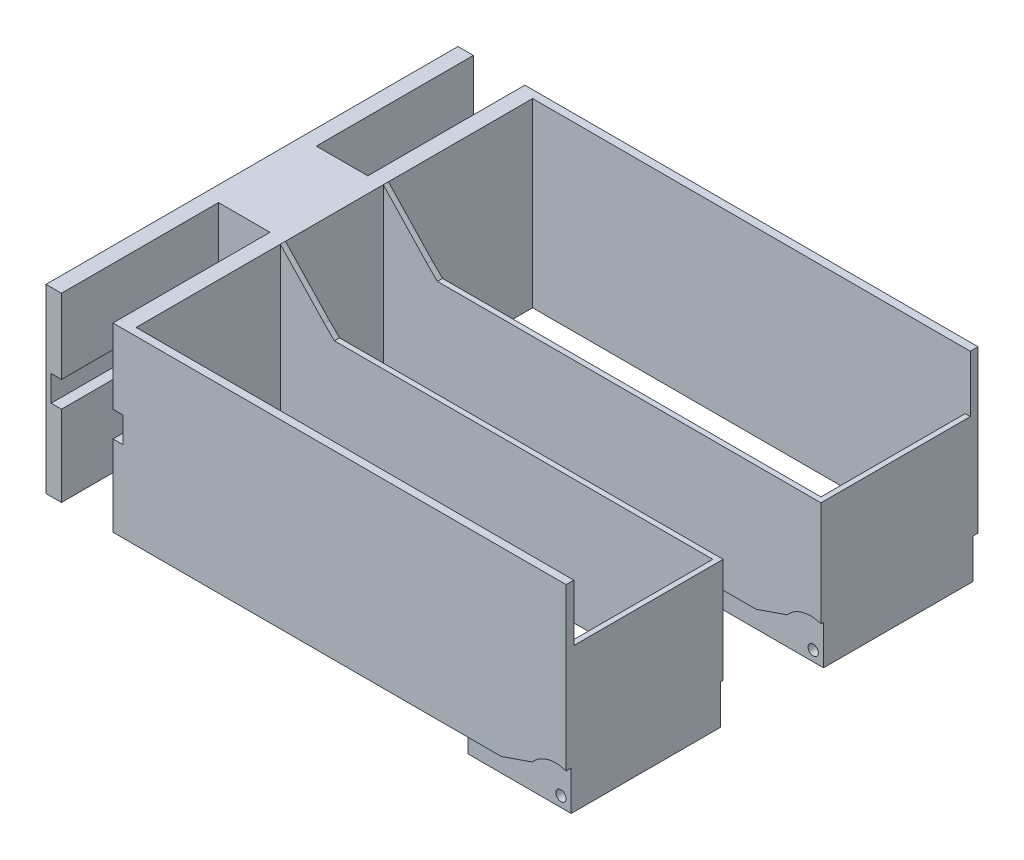
from build123d import *

# Parameters (mm, degrees)
SKETCH4_W                 = 85
SKETCH4_H                 = 39
BOSS_EXTRUDE2_DEPTH       = 30
BOSS_EXTRUDE3_DEPTH       = 39
SKETCH7_W                 = 84
SKETCH7_H                 = 28
CUT_EXTRUDE1_DEPTH        = 39
CUT_EXTRUDE2_DEPTH        = 1
SKETCH9_W                 = 1
SKETCH9_H                 = 9
CUT_EXTRUDE4_DEPTH        = 28
SKETCH19_W                = 31
SKETCH19_H                = 39
BOSS_EXTRUDE4_DEPTH       = 2
SKETCH20_W                = 3
SKETCH20_H                = 39
BOSS_EXTRUDE5_DEPTH       = 9
SKETCH38_W                = 1
SKETCH38_H                = 29
BOSS_EXTRUDE6_DEPTH       = 9
SKETCH39_W                = 1
SKETCH39_H                = 39
BOSS_EXTRUDE7_DEPTH       = 47.410129
BOSS_EXTRUDE8_DEPTH       = 28
SKETCH42_W                = 2
SKETCH42_H                = 5
CUT_EXTRUDE5_DEPTH        = 30
BOSS_EXTRUDE9_DEPTH       = 1
SKETCH44_R                = 1
CUT_EXTRUDE7_DEPTH        = 32
SKETCH46_W                = 85
SKETCH46_H                = 3.803593904
CUT_EXTRUDE8_DEPTH        = 1
CUT_EXTRUDE9_START        = -1
SKETCH48_W                = 65
SKETCH48_H                = 1.901796952
CUT_EXTRUDE9_DEPTH        = 30
SKETCH49_R                = 6
CUT_EXTRUDE10_DEPTH       = 1
CUT_EXTRUDE11_START       = -3
SKETCH50_W                = 31
SKETCH50_H                = 1.901796952
CUT_EXTRUDE11_DEPTH       = 3
SKETCH52_W                = 3
SKETCH52_H                = 39
BOSS_EXTRUDE10_DEPTH      = 0.5
CUT_EXTRUDE13_START       = -85
SKETCH56_W                = 1
SKETCH56_H                = 35.196406096
CUT_EXTRUDE13_DEPTH       = 85
SKETCH58_W                = 88
SKETCH58_H                = 39
CUT_EXTRUDE14_DEPTH       = 0.5
SKETCH59_W                = 88
SKETCH59_H                = 39
CUT_EXTRUDE15_DEPTH       = 0.5
SKETCH60_W                = 19
SKETCH60_H                = 37.098203048
BOSS_EXTRUDE11_DEPTH      = 10
BOSS_EXTRUDE12_DEPTH      = 30.5
BOSS_EXTRUDE12_DEPTH_BACK = 49.5
SKETCH61_W                = 3
SKETCH61_H                = 37.098203048
MIRROR13_COPY_1_SKETCH_W  = 2
MIRROR13_COPY_1_SKETCH_H  = 5
MIRROR13_COPY_1_DEPTH     = 30
MIRROR13_COPY_2_SKETCH_W  = 2
MIRROR13_COPY_2_SKETCH_H  = 5
MIRROR13_COPY_2_DEPTH     = 30
SKETCH63_W                = 85
SKETCH63_H                = 3.803593904
CUT_EXTRUDE16_DEPTH       = 0.5
MIRROR15_COPY_1_SKETCH_W  = 85
MIRROR15_COPY_1_SKETCH_H  = 3.803593904
MIRROR15_COPY_1_DEPTH     = 0.5
SKETCH66_R                = 6
CUT_EXTRUDE17_DEPTH       = 0.5
MIRROR17_COPY_1_SKETCH_R  = 6
MIRROR17_COPY_1_DEPTH     = 0.5
CHAMFER3_START            = 24.587959213
CHAMFER3_OUTLINE_W        = 9
CHAMFER3_OUTLINE_H        = 0.5
CHAMFER3_DEPTH            = 7.695233043
SKETCH67_W                = 3
SKETCH67_H                = 19
CUT_EXTRUDE18_DEPTH       = 1.901797
SKETCH72_W                = 65
SKETCH72_H                = 0.5
CUT_EXTRUDE21_DEPTH       = 1.901797
MIRROR20_COPY_1_SKETCH_W  = 65
MIRROR20_COPY_1_SKETCH_H  = 0.5
MIRROR20_COPY_1_DEPTH     = 1.901797
SKETCH74_W                = 7.418761949
SKETCH74_H                = 3.803593904
BOSS_EXTRUDE13_DEPTH      = 2
MIRROR22_COPY_1_SKETCH_W  = 7.418761949
MIRROR22_COPY_1_SKETCH_H  = 3.803593904
MIRROR22_COPY_1_DEPTH     = 2
CUT_EXTRUDE31_START       = -16
SKETCH79_W                = 80
SKETCH79_H                = 1.901796952
CUT_EXTRUDE31_DEPTH       = 16
SKETCH81_W                = 94
SKETCH81_H                = 1
CUT_EXTRUDE33_DEPTH       = 2
CUT_EXTRUDE34_START       = -11
SKETCH80_W                = 1
SKETCH80_H                = 29
CUT_EXTRUDE34_DEPTH       = 11
CHAMFER5_SIZE             = 2
CHAMFER5_OF_MIRROR23_SIZE = 2


with BuildPart() as part:
    # Sketch4 → Boss-Extrude2 (new body)
    with BuildSketch(Plane.XY):
        Rectangle(SKETCH4_W, SKETCH4_H)
    extrude(amount=BOSS_EXTRUDE2_DEPTH)

    # Sketch6 → Boss-Extrude3 (add)
    with BuildSketch(Plane(origin=(0, 19.5, 0), x_dir=(1, 0, 0), z_dir=(0, 1, 0))):
        Polygon((-4.910129242, 0), (-4.910129242, 1), (-43.5, 1), (-43.5, -30), (-42.5, -30), (-42.5, 0), align=None)
    extrude(amount=-BOSS_EXTRUDE3_DEPTH)

    # Sketch7 → Cut-Extrude1 (cut)
    with BuildSketch(Plane(origin=(0, 19.5, 0), x_dir=(1, 0, 0), z_dir=(0, 1, 0))):
        with Locations((-0.5, -15)):
            Rectangle(SKETCH7_W, SKETCH7_H)
    extrude(amount=-CUT_EXTRUDE1_DEPTH, mode=Mode.SUBTRACT)

    # Angled cut → Cut-Extrude2 (cut)
    with BuildSketch(Plane.XY.offset(30)):
        Polygon((12.07, 10.5), (42.5, 10.5), (42.5, 19.5), (-42.5, 19.5), (-34, 10.5), align=None)
    extrude(amount=-CUT_EXTRUDE2_DEPTH, mode=Mode.SUBTRACT)

    # Sketch9 → Cut-Extrude4 (cut)
    with BuildSketch(Plane.XY.offset(29)):
        with Locations((42, 15)):
            Rectangle(SKETCH9_W, SKETCH9_H)
    extrude(amount=-CUT_EXTRUDE4_DEPTH, mode=Mode.SUBTRACT)

    # Sketch19 → Boss-Extrude4 (add)
    with BuildSketch(Plane.ZY.offset(43.5)):
        with Locations((14.5, 0)):
            Rectangle(SKETCH19_W, SKETCH19_H)
    extrude(amount=BOSS_EXTRUDE4_DEPTH)

    # Sketch20 → Boss-Extrude5 (add)
    with BuildSketch(Plane.XY.offset(30)):
        with Locations((-44, 0)):
            Rectangle(SKETCH20_W, SKETCH20_H)
    extrude(amount=BOSS_EXTRUDE5_DEPTH)

    # Sketch38 → Boss-Extrude6 (add)
    with BuildSketch(Plane(origin=(0, 10.5, 0), x_dir=(1, 0, 0), z_dir=(0, 1, 0))):
        with Locations((42, -15.5)):
            Rectangle(SKETCH38_W, SKETCH38_H)
    extrude(amount=BOSS_EXTRUDE6_DEPTH)

    # Sketch39 → Boss-Extrude7 (add)
    with BuildSketch(Plane(origin=(-4.910129242, 0, 0), x_dir=(0, 0, -1), z_dir=(1, 0, 0))):
        with Locations((0.5, 0)):
            Rectangle(SKETCH39_W, SKETCH39_H)
    extrude(amount=BOSS_EXTRUDE7_DEPTH)

    # Sketch40 → Boss-Extrude8 (add)
    with BuildSketch(Plane(origin=(0, 0, 29), x_dir=(-1, 0, 0), z_dir=(0, 0, -1))):
        Polygon((-42.5, -19.5), (-42.5, 0), (-22.5, -19.5), align=None)
    extrude(amount=BOSS_EXTRUDE8_DEPTH)

    # Sketch42 → Cut-Extrude5 (cut)
    with BuildSketch(Plane(origin=(0, 0, -1), x_dir=(-1, 0, 0), z_dir=(0, 0, -1))):
        with Locations((44.5, 2.5)):
            Rectangle(SKETCH42_W, SKETCH42_H)
    cut_extrude5 = extrude(amount=-CUT_EXTRUDE5_DEPTH, mode=Mode.SUBTRACT)

    # Sketch45 → Boss-Extrude9 (add)
    with BuildSketch(Plane.XY.offset(30)):
        Polygon((-42.5, 19.5), (-42.5, -19.5), (42.5, -19.5), (42.5, 19.5), (41.5, 19.5), (41.5, 10.5), (-34, 10.5), align=None)
    extrude(amount=BOSS_EXTRUDE9_DEPTH)

    # Sketch44 → Cut-Extrude7 (cut)
    with BuildSketch(Plane.XY.offset(-1)):
        with Locations((40.5, -17.5)):
            Circle(SKETCH44_R)
    extrude(amount=CUT_EXTRUDE7_DEPTH, mode=Mode.SUBTRACT)

    # Sketch46 → Cut-Extrude8 (cut)
    with BuildSketch(Plane.XY.offset(31)):
        with Locations((0, -17.598203048)):
            Rectangle(SKETCH46_W, SKETCH46_H)
    cut_extrude8 = extrude(amount=-CUT_EXTRUDE8_DEPTH, mode=Mode.SUBTRACT)

    # Mirror1: Cut-Extrude8 across plane
    add(cut_extrude8.mirror(Plane.XY.offset(15)), mode=Mode.SUBTRACT)

    # Sketch48 → Cut-Extrude9 (cut)
    with BuildSketch(Plane(origin=(0, 0, 29), x_dir=(-1, 0, 0), z_dir=(0, 0, -1)).offset(CUT_EXTRUDE9_START)):
        with Locations((10, -18.549101524)):
            Rectangle(SKETCH48_W, SKETCH48_H)
    extrude(amount=CUT_EXTRUDE9_DEPTH, mode=Mode.SUBTRACT)

    # Sketch49 → Cut-Extrude10 (cut)
    with BuildSketch(Plane(origin=(0, 0, -1), x_dir=(-1, 0, 0), z_dir=(0, 0, -1))):
        with Locations((-40.5, -17.5)):
            Circle(SKETCH49_R)
    cut_extrude10 = extrude(amount=-CUT_EXTRUDE10_DEPTH, mode=Mode.SUBTRACT)

    # Chamfer1
    # the kernel refuses this chamfer: 5.980598359, 5 mm, written as the material it takes off along each edge
    with BuildSketch(Plane(origin=(34.777496262, -15.696406096, 0), x_dir=(0.4822071205961933, 0.8760572429050103, 0), z_dir=(0, 0, -1))) as chamfer1_piece_1:
        with BuildLine():
            Line((2.536104825, 0.160553083), (-2.520260012, -4.417082469))
            Line((-2.520260012, -4.417082469), (-2.625046943, -4.359404727))
            ThreePointArc((-2.625046943, -4.359404727), (-1.330775488, -2.169655928), (-0.10478693, 0.057677742))
            Line((-0.10478693, 0.057677742), (0.023511338, 0.117278471))
            ThreePointArc((0.023511338, 0.117278471), (1.269229547, 0.003245098), (2.512593487, 0.277831553))
            Line((2.512593487, 0.277831553), (2.536104825, 0.160553083))
        make_face()
    extrude(amount=13.71375438, mode=Mode.SUBTRACT)

    # Mirror5: Cut-Extrude10 across plane
    add(cut_extrude10.mirror(Plane.XY.offset(15)), mode=Mode.SUBTRACT)

    # Chamfer2
    # the kernel refuses this chamfer: 5, 3.700015876 mm, written as the material it takes off along each edge
    with BuildSketch(Plane(origin=(34.777496262, -15.696406096, 30), x_dir=(-1, 0, 0), z_dir=(0, 0, 1))) as chamfer2_piece_1:
        with BuildLine():
            Line((4.531412713, 0.062382614), (-1.046280636, -1.768725655))
            Line((-1.046280636, -1.768725655), (-1.127384723, -1.710226706))
            ThreePointArc((-1.127384723, -1.710226706), (-0.481456561, -0.905912415), (-0.095375062, 0.030059898))
            Line((-0.095375062, 0.030059898), (0, 0.1))
            ThreePointArc((0, 0.1), (2.265706356, 0.1), (4.531412713, 0.162382614))
            Line((4.531412713, 0.162382614), (4.531412713, 0.062382614))
        make_face()
    extrude(amount=12.329605235, mode=Mode.SUBTRACT)

    # Sketch50 → Cut-Extrude11 (cut)
    with BuildSketch(Plane(origin=(-42.5, 0, 0), x_dir=(0, 0, -1), z_dir=(1, 0, 0)).offset(CUT_EXTRUDE11_START)):
        with Locations((-14.5, -18.549101524)):
            Rectangle(SKETCH50_W, SKETCH50_H)
    extrude(amount=CUT_EXTRUDE11_DEPTH, mode=Mode.SUBTRACT)

    # Sketch52 → Boss-Extrude10 (add)
    with BuildSketch(Plane.XY.offset(39)):
        with Locations((-44, 0)):
            Rectangle(SKETCH52_W, SKETCH52_H)
    extrude(amount=BOSS_EXTRUDE10_DEPTH)

    # Mirror8: part across plane


with BuildPart() as part_1:
    add(part.part)
    add(part.part.mirror(Plane.XY.offset(39.5)))

    # Sketch56 → Cut-Extrude13 (cut)
    with BuildSketch(Plane(origin=(42.5, 0, 0), x_dir=(0, 0, -1), z_dir=(1, 0, 0)).offset(CUT_EXTRUDE13_START)):
        with Locations((-30.5, 1.901796952)):
            Rectangle(SKETCH56_W, SKETCH56_H)
    cut_extrude13 = extrude(amount=CUT_EXTRUDE13_DEPTH, mode=Mode.SUBTRACT)

    # Mirror11: Cut-Extrude13 across plane
    add(cut_extrude13.mirror(Plane.XY.offset(39.5)), mode=Mode.SUBTRACT)

    # Sketch58 → Cut-Extrude14 (cut)
    with BuildSketch(Plane(origin=(0, 0, -1), x_dir=(-1, 0, 0), z_dir=(0, 0, -1))):
        with Locations((1.5, 0)):
            Rectangle(SKETCH58_W, SKETCH58_H)
    extrude(amount=-CUT_EXTRUDE14_DEPTH, mode=Mode.SUBTRACT)

    # Sketch59 → Cut-Extrude15 (cut)
    with BuildSketch(Plane.XY.offset(80)):
        with Locations((-1.5, 0)):
            Rectangle(SKETCH59_W, SKETCH59_H)
    extrude(amount=-CUT_EXTRUDE15_DEPTH, mode=Mode.SUBTRACT)

    # Sketch60 → Boss-Extrude11 (add)
    with BuildSketch(Plane.ZY.offset(45.5)):
        with Locations((39.5, 0.950898476)):
            Rectangle(SKETCH60_W, SKETCH60_H)
    extrude(amount=BOSS_EXTRUDE11_DEPTH)

    # Sketch61 → Boss-Extrude12 (add, two sides: drawn at the far end of the back side and taken through both)
    with BuildSketch(Plane(origin=(0, 0, 30), x_dir=(-1, 0, 0), z_dir=(0, 0, -1)).offset(-BOSS_EXTRUDE12_DEPTH_BACK)):
        with Locations((57, 0.950898476)):
            Rectangle(SKETCH61_W, SKETCH61_H)
    extrude(amount=BOSS_EXTRUDE12_DEPTH + BOSS_EXTRUDE12_DEPTH_BACK)

    # Mirror12: Cut-Extrude5 across plane
    add(cut_extrude5.mirror(Plane.ZY.offset(50.5)), mode=Mode.SUBTRACT)

    # Mirror13 copy 1 sketch → Mirror13 copy 1 (cut)
    with BuildSketch(Plane(origin=(-101, 0, 80), x_dir=(1, 0, 0), z_dir=(0, 0, 1))):
        with Locations((44.5, 2.5)):
            Rectangle(MIRROR13_COPY_1_SKETCH_W, MIRROR13_COPY_1_SKETCH_H)
    extrude(amount=-MIRROR13_COPY_1_DEPTH, mode=Mode.SUBTRACT)

    # Mirror13 copy 2 sketch → Mirror13 copy 2 (cut)
    with BuildSketch(Plane(origin=(0, 0, 80), x_dir=(-1, 0, 0), z_dir=(0, 0, 1))):
        with Locations((44.5, -2.5)):
            Rectangle(MIRROR13_COPY_2_SKETCH_W, MIRROR13_COPY_2_SKETCH_H)
    extrude(amount=-MIRROR13_COPY_2_DEPTH, mode=Mode.SUBTRACT)

    # Sketch63 → Cut-Extrude16 (cut)
    with BuildSketch(Plane(origin=(0, 0, 0), x_dir=(-1, 0, 0), z_dir=(0, 0, -1))):
        with Locations((0, -17.598203048)):
            Rectangle(SKETCH63_W, SKETCH63_H)
    cut_extrude16 = extrude(amount=-CUT_EXTRUDE16_DEPTH, mode=Mode.SUBTRACT)

    # Mirror14: Cut-Extrude16 across plane
    add(cut_extrude16.mirror(Plane.XY.offset(15)), mode=Mode.SUBTRACT)

    # Mirror15: Cut-Extrude16 across plane
    add(cut_extrude16.mirror(Plane.XY.offset(39.5)), mode=Mode.SUBTRACT)

    # Mirror15 copy 1 sketch → Mirror15 copy 1 (cut)
    with BuildSketch(Plane(origin=(0, 0, 49), x_dir=(-1, 0, 0), z_dir=(0, 0, -1))):
        with Locations((0, -17.598203048)):
            Rectangle(MIRROR15_COPY_1_SKETCH_W, MIRROR15_COPY_1_SKETCH_H)
    extrude(amount=-MIRROR15_COPY_1_DEPTH, mode=Mode.SUBTRACT)

    # Sketch66 → Cut-Extrude17 (cut)
    with BuildSketch(Plane(origin=(0, 0, 0), x_dir=(-1, 0, 0), z_dir=(0, 0, -1))):
        with Locations((-40.5, -17.5)):
            Circle(SKETCH66_R)
    cut_extrude17 = extrude(amount=-CUT_EXTRUDE17_DEPTH, mode=Mode.SUBTRACT)

    # Mirror16: Cut-Extrude17 across plane
    add(cut_extrude17.mirror(Plane.XY.offset(15)), mode=Mode.SUBTRACT)

    # Mirror17: Cut-Extrude17 across plane
    add(cut_extrude17.mirror(Plane.XY.offset(39.5)), mode=Mode.SUBTRACT)

    # Mirror17 copy 1 sketch → Mirror17 copy 1 (cut)
    with BuildSketch(Plane(origin=(0, 0, 49), x_dir=(-1, 0, 0), z_dir=(0, 0, -1))):
        with Locations((-40.5, -17.5)):
            Circle(MIRROR17_COPY_1_SKETCH_R)
    extrude(amount=-MIRROR17_COPY_1_DEPTH, mode=Mode.SUBTRACT)

    # Chamfer3: read off the stored shape, not the designer's step
    # Chamfer3 outline → Chamfer3 (cut)
    with BuildSketch(Plane(origin=(0, 0, 0), x_dir=(0.9454325743674387, 0.32581781308724894, 0), z_dir=(0.32581781308724894, -0.9454325743674388, 0)).offset(CHAMFER3_START)):
        with Locations((26.5, 0.25)):
            Rectangle(CHAMFER3_OUTLINE_W, CHAMFER3_OUTLINE_H)
    extrude(amount=CHAMFER3_DEPTH, mode=Mode.SUBTRACT)

    # Chamfer4
    # the kernel refuses this chamfer: 5.980598359, 5, 4.195498156 mm, written as the material it takes off along each edge
    with BuildSketch(Plane(origin=(34.777496262, -15.696406096, 29.5), x_dir=(0.48220712059619303, 0.8760572429050105, 0), z_dir=(0, 0, 1))) as chamfer4_piece_1:
        with BuildLine():
            Line((2.536104825, -0.160553083), (-2.520260012, 4.417082469))
            Line((-2.520260012, 4.417082469), (-2.625046943, 4.359404727))
            ThreePointArc((-2.625046943, 4.359404727), (-1.330775488, 2.169655928), (-0.10478693, -0.057677742))
            Line((-0.10478693, -0.057677742), (0.023511338, -0.117278471))
            ThreePointArc((0.023511338, -0.117278471), (1.269229547, -0.003245098), (2.512593487, -0.277831553))
            Line((2.512593487, -0.277831553), (2.536104825, -0.160553083))
        make_face()
    extrude(amount=13.21375438, mode=Mode.SUBTRACT)
    with BuildSketch(Plane(origin=(34.777496262, -15.696406096, 78.5), x_dir=(-1, 0, 0), z_dir=(0, 0, 1))) as chamfer4_piece_2:
        with BuildLine():
            Line((5.084904413, 0.077943419), (-1.363581496, -2.144353161))
            Line((-1.363581496, -2.144353161), (-1.454986815, -2.067203369))
            ThreePointArc((-1.454986815, -2.067203369), (-0.614874417, -1.110352928), (-0.114079988, 0.035955236))
            Line((-0.114079988, 0.035955236), (0, 0.119611967))
            ThreePointArc((0, 0.119611967), (2.542452207, 0.119611967), (5.084904413, 0.197555386))
            Line((5.084904413, 0.197555386), (5.084904413, 0.077943419))
        make_face()
    extrude(amount=13.21375438, mode=Mode.SUBTRACT)
    with BuildSketch(Plane(origin=(34.777496262, -15.696406096, 49.5), x_dir=(0.48220712059619303, 0.8760572429050105, 0), z_dir=(0, 0, -1))) as chamfer4_piece_3:
        with BuildLine():
            Line((2.536104825, 0.160553083), (-2.520260012, -4.417082469))
            Line((-2.520260012, -4.417082469), (-2.625046943, -4.359404727))
            ThreePointArc((-2.625046943, -4.359404727), (-1.330775488, -2.169655928), (-0.10478693, 0.057677742))
            Line((-0.10478693, 0.057677742), (0.023511338, 0.117278471))
            ThreePointArc((0.023511338, 0.117278471), (1.269229547, 0.003245098), (2.512593487, 0.277831553))
            Line((2.512593487, 0.277831553), (2.536104825, 0.160553083))
        make_face()
    extrude(amount=13.21375438, mode=Mode.SUBTRACT)

    # Sketch67 → Cut-Extrude18 (cut)
    with BuildSketch(Plane.XZ.offset(19.5)):
        with Locations((-44, 39.5)):
            Rectangle(SKETCH67_W, SKETCH67_H)
    extrude(amount=-CUT_EXTRUDE18_DEPTH, mode=Mode.SUBTRACT)

    # Sketch72 → Cut-Extrude21 (cut)
    with BuildSketch(Plane.XZ.offset(17.598203048)):
        with Locations((-10, 0.75)):
            Rectangle(SKETCH72_W, SKETCH72_H)
    cut_extrude21 = extrude(amount=-CUT_EXTRUDE21_DEPTH, mode=Mode.SUBTRACT)

    # Mirror19: Cut-Extrude21 across plane
    add(cut_extrude21.mirror(Plane.XY.offset(15)), mode=Mode.SUBTRACT)

    # Mirror20: Cut-Extrude21 across plane
    add(cut_extrude21.mirror(Plane.XY.offset(39.5)), mode=Mode.SUBTRACT)

    # Mirror20 copy 1 sketch → Mirror20 copy 1 (cut)
    with BuildSketch(Plane(origin=(0, -17.598203048, 49), x_dir=(1, 0, 0), z_dir=(0, -1, 0))):
        with Locations((-10, 0.75)):
            Rectangle(MIRROR20_COPY_1_SKETCH_W, MIRROR20_COPY_1_SKETCH_H)
    extrude(amount=-MIRROR20_COPY_1_DEPTH, mode=Mode.SUBTRACT)

    # Sketch74 → Boss-Extrude13 (add)
    with BuildSketch(Plane(origin=(0, 0, 0.5), x_dir=(-1, 0, 0), z_dir=(0, 0, -1))):
        with Locations((-26.209380975, -17.598203048)):
            Rectangle(SKETCH74_W, SKETCH74_H)
    boss_extrude13 = extrude(amount=-BOSS_EXTRUDE13_DEPTH)

    # Mirror21: Boss-Extrude13 across plane
    add(boss_extrude13.mirror(Plane.XY.offset(15)))

    # Mirror22: Boss-Extrude13 across plane
    add(boss_extrude13.mirror(Plane.XY.offset(39.5)))

    # Mirror22 copy 1 sketch → Mirror22 copy 1 (add)
    with BuildSketch(Plane(origin=(0, 0, 49.5), x_dir=(-1, 0, 0), z_dir=(0, 0, -1))):
        with Locations((-26.209380975, -17.598203048)):
            Rectangle(MIRROR22_COPY_1_SKETCH_W, MIRROR22_COPY_1_SKETCH_H)
    extrude(amount=-MIRROR22_COPY_1_DEPTH)

    # Sketch79 → Cut-Extrude31 (cut)
    with BuildSketch(Plane(origin=(-42.5, 0, 0), x_dir=(0, 0, -1), z_dir=(1, 0, 0)).offset(CUT_EXTRUDE31_START)):
        with Locations((-39.5, -16.647304572)):
            Rectangle(SKETCH79_W, SKETCH79_H)
    cut_extrude31 = extrude(amount=CUT_EXTRUDE31_DEPTH, mode=Mode.SUBTRACT)

    # Sketch81 → Cut-Extrude33 (cut)
    with BuildSketch(Plane(origin=(0, 10.5, 0), x_dir=(1, 0, 0), z_dir=(0, 1, 0))):
        with Locations((13, -29.5)):
            Rectangle(SKETCH81_W, SKETCH81_H)
    cut_extrude33 = extrude(amount=-CUT_EXTRUDE33_DEPTH, mode=Mode.SUBTRACT)

    # Sketch80 → Cut-Extrude34 (cut)
    with BuildSketch(Plane(origin=(0, 19.5, 0), x_dir=(1, 0, 0), z_dir=(0, 1, 0)).offset(CUT_EXTRUDE34_START)):
        with Locations((42, -15.5)):
            Rectangle(SKETCH80_W, SKETCH80_H)
    cut_extrude34 = extrude(amount=CUT_EXTRUDE34_DEPTH, mode=Mode.SUBTRACT)

    # Chamfer5
    chamfer5_edges = [part_1.edges().sort_by_distance(p)[0] for p in [
        (-34, 8.5, 29.5),
    ]]
    chamfer(chamfer5_edges, length=CHAMFER5_SIZE - 0.0001)  # a hair under: the kernel refuses the full size

    # Mirror23: Cut-Extrude31, Cut-Extrude33, Cut-Extrude34 across plane
    add(cut_extrude31.mirror(Plane.XY.offset(39.5)), mode=Mode.SUBTRACT)
    add(cut_extrude33.mirror(Plane.XY.offset(39.5)), mode=Mode.SUBTRACT)
    add(cut_extrude34.mirror(Plane.XY.offset(39.5)), mode=Mode.SUBTRACT)

    # Chamfer5 of Mirror23
    chamfer5_of_mirror23_edges = [part_1.edges().sort_by_distance(p)[0] for p in [
        (-34, 8.5, 49.5),
    ]]
    chamfer(chamfer5_of_mirror23_edges, length=CHAMFER5_OF_MIRROR23_SIZE - 0.0001)  # a hair under: the kernel refuses the full size


solid = part_1.part
